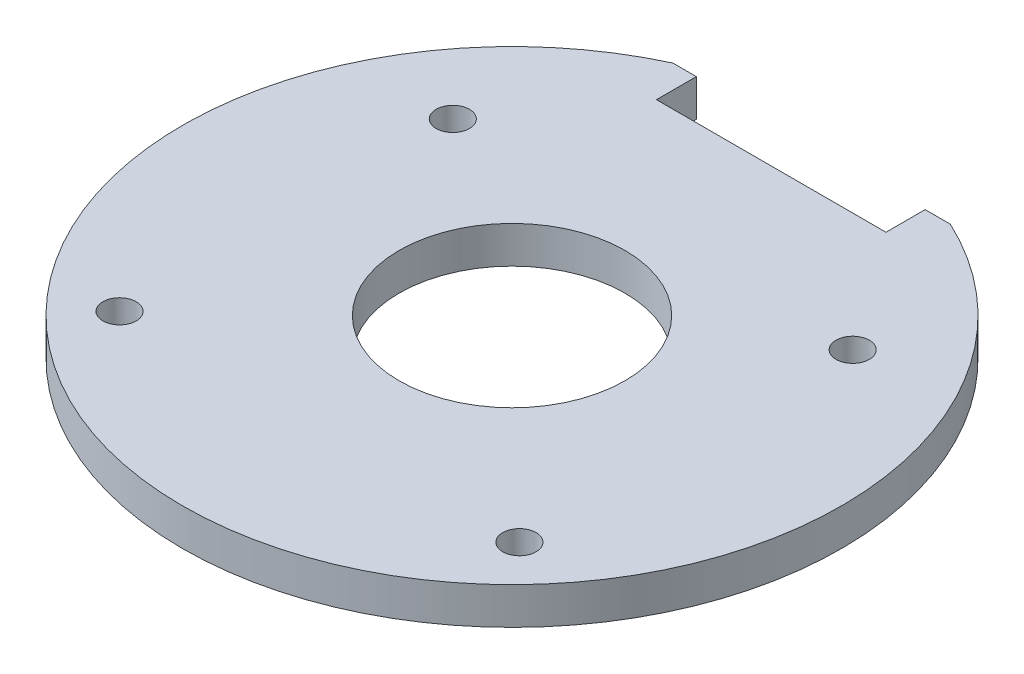
from build123d import *

# Parameters (mm, degrees)
SKETCH_2_R      = 15.25
SKETCH_2_R_2    = 2.25
EXTRUDE_1_DEPTH = 5


with BuildPart() as part:
    # Эскиз2 → Бобышка-Вытянуть1 (new body)
    with BuildSketch(Plane(origin=(0, 0, 0), x_dir=(1, 0, 0), z_dir=(0, 1, 0))):
        with BuildLine():
            Line((-15.5, 35), (15.5, 35))
            Line((15.5, 35), (15.5, 40.286336603))
            Line((15.5, 40.286336603), (18.901351356, 40.286336603))
            ThreePointArc((18.901351356, 40.286336603), (-0.126903456, -44.49981905), (-18.671270685, 40.393485254))
            Line((-18.671270685, 40.393485254), (-15.5, 40.393485254))
            Line((-15.5, 40.393485254), (-15.5, 35))
        make_face()
        Circle(SKETCH_2_R, mode=Mode.SUBTRACT)
        with Locations((-27, 19)):
            Circle(SKETCH_2_R_2, mode=Mode.SUBTRACT)
        with Locations((27, 19)):
            Circle(SKETCH_2_R_2, mode=Mode.SUBTRACT)
        with Locations((27, -26)):
            Circle(SKETCH_2_R_2, mode=Mode.SUBTRACT)
        with Locations((-27, -26)):
            Circle(SKETCH_2_R_2, mode=Mode.SUBTRACT)
    extrude(amount=EXTRUDE_1_DEPTH)


solid = part.part
